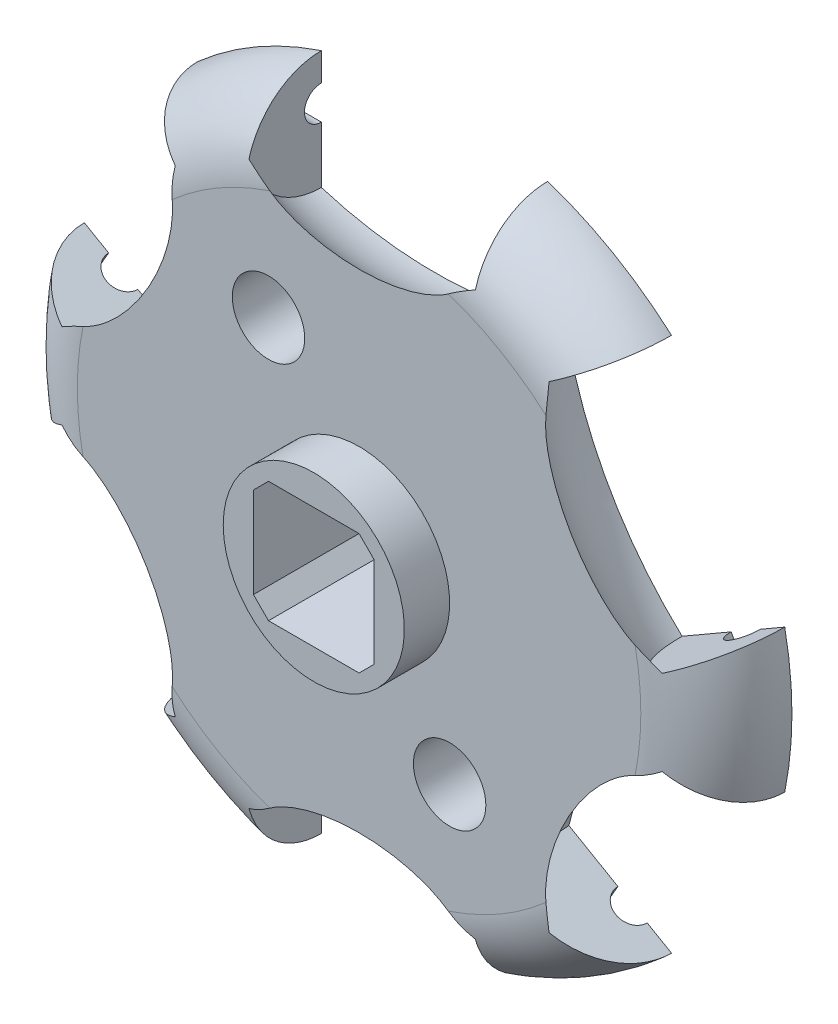
from build123d import *

# Parameters (mm, degrees)
SKETCH1_R           = 18.796
BOSS_EXTRUDE1_DEPTH = 3.96875
FILLET1_R           = 3.97891
SKETCH2_R           = 1.905
SKETCH2_W           = 6.35
SKETCH2_H           = 6.35
CUT_EXTRUDE1_DEPTH  = 27.876183384
SKETCH6_R           = 0.889
CUT_EXTRUDE2_DEPTH  = 7.9375
CIRPATTERN1_COUNT   = 6
SKETCH7_R           = 4.7625
SKETCH7_W           = 6.35
SKETCH7_H           = 6.35
BOSS_EXTRUDE2_DEPTH = 2.38125
CHAMFER1_SIZE       = 0.79375


with BuildPart() as part:
    # Sketch1 → Boss-Extrude1 (new body)
    with BuildSketch(Plane.XY):
        Circle(SKETCH1_R)
    extrude(amount=BOSS_EXTRUDE1_DEPTH)

    # Fillet1
    # the kernel refuses this fillet: 3.97891 mm, written as the material it takes off along each edge
    with BuildSketch(Plane(origin=(0, 0, 3.96875), x_dir=(1, 0, 0), z_dir=(0, -1, 0))) as fillet1_piece_1:
        with BuildLine():
            CenterArc((18.796 - FILLET1_R, -FILLET1_R), FILLET1_R, 0, 90)
            Line((18.796 - FILLET1_R, 0), (18.796, 0))
            Line((18.796, 0), (18.796, -FILLET1_R))
        make_face()
    revolve(axis=Axis((0, 0, 3.96875), (0, 0, 1)), mode=Mode.SUBTRACT)

    # Sketch2 → Cut-Extrude1 (cut, through all)
    with BuildSketch(Plane.XY.offset(3.96875)):
        with Locations((-4.7625, 8.248891971)):
            Circle(SKETCH2_R)
        with Locations((4.7625, -8.248891971)):
            Circle(SKETCH2_R)
        Rectangle(SKETCH2_W, SKETCH2_H)
    extrude(amount=-CUT_EXTRUDE1_DEPTH, mode=Mode.SUBTRACT)

    # Sketch5 → Cut-Revolve1 (revolve, cut)
    with BuildSketch(Plane.XY):
        with BuildLine():
            Line((-5.953125, 15.46225), (5.953125, 15.46225))
            Line((5.953125, 15.46225), (5.953125, 19.328756176))
            ThreePointArc((5.953125, 19.328756176), (0, 20.22475), (-5.953125, 19.328756176))
            Line((-5.953125, 19.328756176), (-5.953125, 15.46225))
        make_face()
    cut_revolve1 = revolve(axis=Axis((-5.953125, 15.46225, 0), (-1, 0, 0)), mode=Mode.SUBTRACT)

    # Sketch6 → Cut-Extrude2 (cut, symmetric)
    with BuildSketch(Plane(origin=(0, 0, 0), x_dir=(0, 0, -1), z_dir=(1, 0, 0))):
        with Locations((0, 15.46225)):
            Circle(SKETCH6_R)
    cut_extrude2 = extrude(amount=CUT_EXTRUDE2_DEPTH, both=True, mode=Mode.SUBTRACT)

    # CirPattern1: Cut-Revolve1, Cut-Extrude2 ×6 about axis
    cirpattern1_axis = Axis((0, 0, 0), (0, 0, 1))
    add([cut_revolve1.rotate(cirpattern1_axis, i * 360 / CIRPATTERN1_COUNT) for i in range(1, CIRPATTERN1_COUNT)], mode=Mode.SUBTRACT)
    add([cut_extrude2.rotate(cirpattern1_axis, i * 360 / CIRPATTERN1_COUNT) for i in range(1, CIRPATTERN1_COUNT)], mode=Mode.SUBTRACT)

    # Sketch7 → Boss-Extrude2 (add)
    with BuildSketch(Plane.XY.offset(3.96875)):
        with Locations(Location((0, 0, 0), (0, 0, 180))):
            Circle(SKETCH7_R)
        Rectangle(SKETCH7_W, SKETCH7_H, mode=Mode.SUBTRACT)
    extrude(amount=BOSS_EXTRUDE2_DEPTH)

    # Chamfer1
    chamfer1_edges = [part.edges().sort_by_distance(p)[0] for p in [
        (3.175, 3.175, 3.175),
        (3.175, -3.175, 3.175),
        (-3.175, -3.175, 3.175),
        (-3.175, 3.175, 3.175),
    ]]
    chamfer(chamfer1_edges, length=CHAMFER1_SIZE)


solid = part.part
